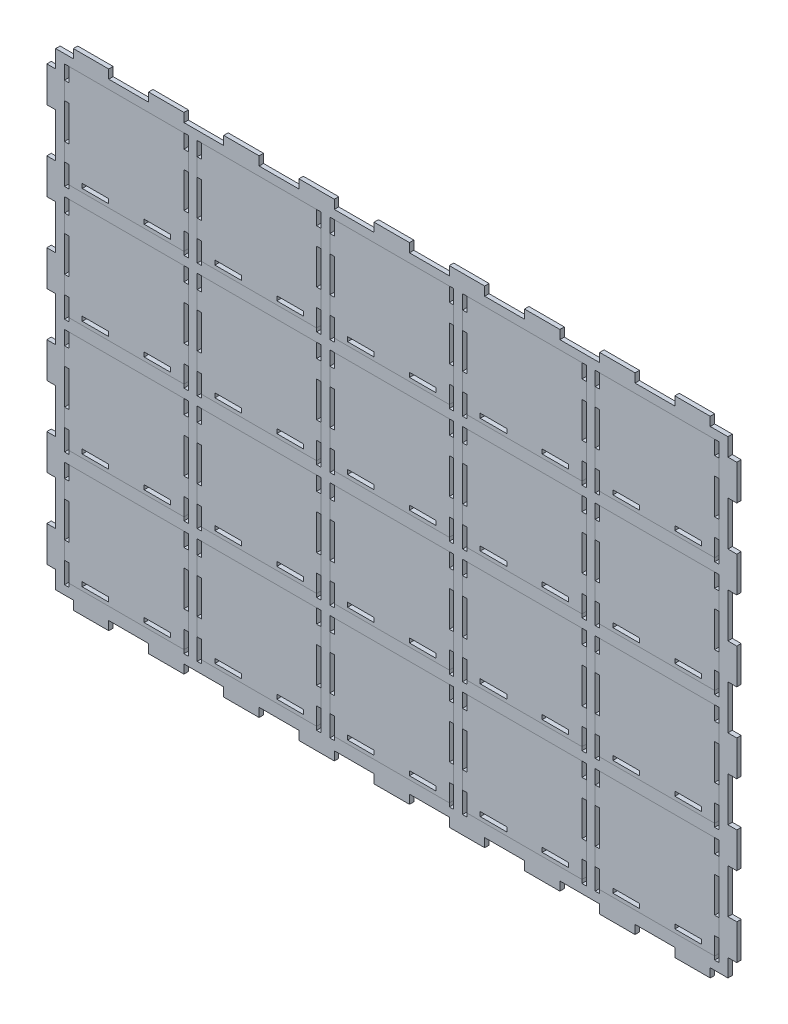
from build123d import *

# Parameters (mm, degrees)
BOSS_EXTRUDE1_DEPTH    = 2.5
SKETCH1_3_W            = 15
SKETCH1_3_H            = 2.5
BOSS_EXTRUDE2_DEPTH    = 2.5
BOSS_EXTRUDE2_2_DEPTH  = 2.5
BOSS_EXTRUDE2_3_DEPTH  = 2.5
BOSS_EXTRUDE2_4_DEPTH  = 2.5
BOSS_EXTRUDE2_5_DEPTH  = 2.5
BOSS_EXTRUDE2_6_DEPTH  = 2.5
BOSS_EXTRUDE2_7_DEPTH  = 2.5
BOSS_EXTRUDE2_8_DEPTH  = 2.5
BOSS_EXTRUDE2_9_DEPTH  = 2.5
BOSS_EXTRUDE2_10_DEPTH = 2.5
BOSS_EXTRUDE2_11_DEPTH = 2.5
BOSS_EXTRUDE2_12_DEPTH = 2.5
BOSS_EXTRUDE2_13_DEPTH = 2.5
BOSS_EXTRUDE2_14_DEPTH = 2.5
BOSS_EXTRUDE2_15_DEPTH = 2.5
BOSS_EXTRUDE2_16_DEPTH = 2.5
BOSS_EXTRUDE2_17_DEPTH = 2.5
BOSS_EXTRUDE2_18_DEPTH = 2.5
BOSS_EXTRUDE2_19_DEPTH = 2.5
BOSS_EXTRUDE2_20_DEPTH = 2.5


with BuildPart() as part:
    # Sketch1 → Boss-Extrude1 (new body)
    with BuildSketch(Plane.XY):
        Polygon((-160, 137.5), (-180, 137.5), (-180, 132.5), (-190, 132.5), (-190, 122.5), (-195, 122.5), (-195, 102.5), (-190, 102.5), (-190, 77.5), (-195, 77.5), (-195, 57.5), (-190, 57.5), (-190, 32.5), (-195, 32.5), (-195, 12.5), (-190, 12.5), (-190, -12.5), (-195, -12.5), (-195, -32.5), (-190, -32.5), (-190, -57.5), (-195, -57.5), (-195, -77.5), (-190, -77.5), (-190, -102.5), (-195, -102.5), (-195, -122.5), (-190, -122.5), (-190, -132.5), (-180, -132.5), (-180, -137.5), (-160, -137.5), (-160, -132.5), (-137.5, -132.5), (-137.5, -137.5), (-117.5, -137.5), (-117.5, -132.5), (-95, -132.5), (-95, -137.5), (-75, -137.5), (-75, -132.5), (-52.5, -132.5), (-52.5, -137.5), (-32.5, -137.5), (-32.5, -132.5), (-10, -132.5), (-10, -137.5), (10, -137.5), (10, -132.5), (32.5, -132.5), (32.5, -137.5), (52.5, -137.5), (52.5, -132.5), (75, -132.5), (75, -137.5), (95, -137.5), (95, -132.5), (117.5, -132.5), (117.5, -137.5), (137.5, -137.5), (137.5, -132.5), (160, -132.5), (160, -137.5), (180, -137.5), (180, -132.5), (190, -132.5), (190, -122.5), (195, -122.5), (195, -102.5), (190, -102.5), (190, -77.5), (195, -77.5), (195, -57.5), (190, -57.5), (190, -32.5), (195, -32.5), (195, -12.5), (190, -12.5), (190, 12.5), (195, 12.5), (195, 32.5), (190, 32.5), (190, 57.5), (195, 57.5), (195, 77.5), (190, 77.5), (190, 102.5), (195, 102.5), (195, 122.5), (190, 122.5), (190, 132.5), (180, 132.5), (180, 137.5), (160, 137.5), (160, 132.5), (137.5, 132.5), (137.5, 137.5), (117.5, 137.5), (117.5, 132.5), (95, 132.5), (95, 137.5), (75, 137.5), (75, 132.5), (52.5, 132.5), (52.5, 137.5), (32.5, 137.5), (32.5, 132.5), (10, 132.5), (10, 137.5), (-10, 137.5), (-10, 132.5), (-32.5, 132.5), (-32.5, 137.5), (-52.5, 137.5), (-52.5, 132.5), (-75, 132.5), (-75, 137.5), (-95, 137.5), (-95, 132.5), (-117.5, 132.5), (-117.5, 137.5), (-137.5, 137.5), (-137.5, 132.5), (-160, 132.5), align=None)
        Polygon((-182.5, -127.5), (-185, -127.5), (-185, -115.5), (-185, -105.5), (-185, -85.5), (-185, -75.5), (-185, -67.5), (-182.5, -67.5), (-117.5, -67.5), (-115, -67.5), (-115, -75.5), (-115, -85.5), (-115, -105.5), (-115, -115.5), (-115, -127.5), (-117.5, -127.5), (-117.5, -125.5), (-182.5, -125.5), align=None, mode=Mode.SUBTRACT)
        Polygon((-107.5, -127.5), (-110, -127.5), (-110, -115.5), (-110, -105.5), (-110, -85.5), (-110, -75.5), (-110, -67.5), (-107.5, -67.5), (-42.5, -67.5), (-40, -67.5), (-40, -75.5), (-40, -85.5), (-40, -105.5), (-40, -115.5), (-40, -127.5), (-42.5, -127.5), (-42.5, -125.5), (-107.5, -125.5), align=None, mode=Mode.SUBTRACT)
        Polygon((-182.5, -62.5), (-185, -62.5), (-185, -50.5), (-185, -40.5), (-185, -20.5), (-185, -10.5), (-185, -2.5), (-182.5, -2.5), (-117.5, -2.5), (-115, -2.5), (-115, -10.5), (-115, -20.5), (-115, -40.5), (-115, -50.5), (-115, -62.5), (-117.5, -62.5), (-117.5, -60.5), (-182.5, -60.5), align=None, mode=Mode.SUBTRACT)
        Polygon((-107.5, -62.5), (-110, -62.5), (-110, -50.5), (-110, -40.5), (-110, -20.5), (-110, -10.5), (-110, -2.5), (-107.5, -2.5), (-42.5, -2.5), (-40, -2.5), (-40, -10.5), (-40, -20.5), (-40, -40.5), (-40, -50.5), (-40, -62.5), (-42.5, -62.5), (-42.5, -60.5), (-107.5, -60.5), align=None, mode=Mode.SUBTRACT)
        Polygon((-32.5, -127.5), (-35, -127.5), (-35, -115.5), (-35, -105.5), (-35, -85.5), (-35, -75.5), (-35, -67.5), (-32.5, -67.5), (32.5, -67.5), (35, -67.5), (35, -75.5), (35, -85.5), (35, -105.5), (35, -115.5), (35, -127.5), (32.5, -127.5), (32.5, -125.5), (-32.5, -125.5), align=None, mode=Mode.SUBTRACT)
        Polygon((42.5, -127.5), (40, -127.5), (40, -115.5), (40, -105.5), (40, -85.5), (40, -75.5), (40, -67.5), (42.5, -67.5), (107.5, -67.5), (110, -67.5), (110, -75.5), (110, -85.5), (110, -105.5), (110, -115.5), (110, -127.5), (107.5, -127.5), (107.5, -125.5), (42.5, -125.5), align=None, mode=Mode.SUBTRACT)
        Polygon((117.5, -127.5), (115, -127.5), (115, -115.5), (115, -105.5), (115, -85.5), (115, -75.5), (115, -67.5), (117.5, -67.5), (182.5, -67.5), (185, -67.5), (185, -75.5), (185, -85.5), (185, -105.5), (185, -115.5), (185, -127.5), (182.5, -127.5), (182.5, -125.5), (117.5, -125.5), align=None, mode=Mode.SUBTRACT)
        Polygon((-32.5, -62.5), (-35, -62.5), (-35, -50.5), (-35, -40.5), (-35, -20.5), (-35, -10.5), (-35, -2.5), (-32.5, -2.5), (32.5, -2.5), (35, -2.5), (35, -10.5), (35, -20.5), (35, -40.5), (35, -50.5), (35, -62.5), (32.5, -62.5), (32.5, -60.5), (-32.5, -60.5), align=None, mode=Mode.SUBTRACT)
        Polygon((42.5, -62.5), (40, -62.5), (40, -50.5), (40, -40.5), (40, -20.5), (40, -10.5), (40, -2.5), (42.5, -2.5), (107.5, -2.5), (110, -2.5), (110, -10.5), (110, -20.5), (110, -40.5), (110, -50.5), (110, -62.5), (107.5, -62.5), (107.5, -60.5), (42.5, -60.5), align=None, mode=Mode.SUBTRACT)
        Polygon((117.5, -62.5), (115, -62.5), (115, -50.5), (115, -40.5), (115, -20.5), (115, -10.5), (115, -2.5), (117.5, -2.5), (182.5, -2.5), (185, -2.5), (185, -10.5), (185, -20.5), (185, -40.5), (185, -50.5), (185, -62.5), (182.5, -62.5), (182.5, -60.5), (117.5, -60.5), align=None, mode=Mode.SUBTRACT)
        Polygon((-182.5, 2.5), (-185, 2.5), (-185, 14.5), (-185, 24.5), (-185, 44.5), (-185, 54.5), (-185, 62.5), (-182.5, 62.5), (-117.5, 62.5), (-115, 62.5), (-115, 54.5), (-115, 44.5), (-115, 24.5), (-115, 14.5), (-115, 2.5), (-117.5, 2.5), (-117.5, 4.5), (-182.5, 4.5), align=None, mode=Mode.SUBTRACT)
        Polygon((-107.5, 2.5), (-110, 2.5), (-110, 14.5), (-110, 24.5), (-110, 44.5), (-110, 54.5), (-110, 62.5), (-107.5, 62.5), (-42.5, 62.5), (-40, 62.5), (-40, 54.5), (-40, 44.5), (-40, 24.5), (-40, 14.5), (-40, 2.5), (-42.5, 2.5), (-42.5, 4.5), (-107.5, 4.5), align=None, mode=Mode.SUBTRACT)
        Polygon((-182.5, 67.5), (-185, 67.5), (-185, 79.5), (-185, 89.5), (-185, 109.5), (-185, 119.5), (-185, 127.5), (-182.5, 127.5), (-117.5, 127.5), (-115, 127.5), (-115, 119.5), (-115, 109.5), (-115, 89.5), (-115, 79.5), (-115, 67.5), (-117.5, 67.5), (-117.5, 69.5), (-182.5, 69.5), align=None, mode=Mode.SUBTRACT)
        Polygon((-107.5, 67.5), (-110, 67.5), (-110, 79.5), (-110, 89.5), (-110, 109.5), (-110, 119.5), (-110, 127.5), (-107.5, 127.5), (-42.5, 127.5), (-40, 127.5), (-40, 119.5), (-40, 109.5), (-40, 89.5), (-40, 79.5), (-40, 67.5), (-42.5, 67.5), (-42.5, 69.5), (-107.5, 69.5), align=None, mode=Mode.SUBTRACT)
        Polygon((-32.5, 2.5), (-35, 2.5), (-35, 14.5), (-35, 24.5), (-35, 44.5), (-35, 54.5), (-35, 62.5), (-32.5, 62.5), (32.5, 62.5), (35, 62.5), (35, 54.5), (35, 44.5), (35, 24.5), (35, 14.5), (35, 2.5), (32.5, 2.5), (32.5, 4.5), (-32.5, 4.5), align=None, mode=Mode.SUBTRACT)
        Polygon((42.5, 2.5), (40, 2.5), (40, 14.5), (40, 24.5), (40, 44.5), (40, 54.5), (40, 62.5), (42.5, 62.5), (107.5, 62.5), (110, 62.5), (110, 54.5), (110, 44.5), (110, 24.5), (110, 14.5), (110, 2.5), (107.5, 2.5), (107.5, 4.5), (42.5, 4.5), align=None, mode=Mode.SUBTRACT)
        Polygon((117.5, 2.5), (115, 2.5), (115, 14.5), (115, 24.5), (115, 44.5), (115, 54.5), (115, 62.5), (117.5, 62.5), (182.5, 62.5), (185, 62.5), (185, 54.5), (185, 44.5), (185, 24.5), (185, 14.5), (185, 2.5), (182.5, 2.5), (182.5, 4.5), (117.5, 4.5), align=None, mode=Mode.SUBTRACT)
        Polygon((-32.5, 67.5), (-35, 67.5), (-35, 79.5), (-35, 89.5), (-35, 109.5), (-35, 119.5), (-35, 127.5), (-32.5, 127.5), (32.5, 127.5), (35, 127.5), (35, 119.5), (35, 109.5), (35, 89.5), (35, 79.5), (35, 67.5), (32.5, 67.5), (32.5, 69.5), (-32.5, 69.5), align=None, mode=Mode.SUBTRACT)
        Polygon((42.5, 67.5), (40, 67.5), (40, 79.5), (40, 89.5), (40, 109.5), (40, 119.5), (40, 127.5), (42.5, 127.5), (107.5, 127.5), (110, 127.5), (110, 119.5), (110, 109.5), (110, 89.5), (110, 79.5), (110, 67.5), (107.5, 67.5), (107.5, 69.5), (42.5, 69.5), align=None, mode=Mode.SUBTRACT)
        Polygon((117.5, 67.5), (115, 67.5), (115, 79.5), (115, 89.5), (115, 109.5), (115, 119.5), (115, 127.5), (117.5, 127.5), (182.5, 127.5), (185, 127.5), (185, 119.5), (185, 109.5), (185, 89.5), (185, 79.5), (185, 67.5), (182.5, 67.5), (182.5, 69.5), (117.5, 69.5), align=None, mode=Mode.SUBTRACT)
    extrude(amount=BOSS_EXTRUDE1_DEPTH)


with BuildPart() as body_2:
    # Sketch1<3> → Boss-Extrude2 (new body)
    with BuildSketch(Plane.XY):
        Polygon((115, 89.5), (115, 79.5), (117.5, 79.5), (117.5, 69.5), (182.5, 69.5), (182.5, 79.5), (185, 79.5), (185, 89.5), (182.5, 89.5), (182.5, 109.5), (185, 109.5), (185, 119.5), (182.5, 119.5), (182.5, 127.5), (117.5, 127.5), (117.5, 119.5), (115, 119.5), (115, 109.5), (117.5, 109.5), (117.5, 89.5), align=None)
        with Locations((132.5, 72.75)):
            Rectangle(SKETCH1_3_W, SKETCH1_3_H, mode=Mode.SUBTRACT)
        with Locations((167.5, 72.75)):
            Rectangle(SKETCH1_3_W, SKETCH1_3_H, mode=Mode.SUBTRACT)
    extrude(amount=BOSS_EXTRUDE2_DEPTH)


with BuildPart() as body_3:
    # Sketch1<3> → Boss-Extrude2 2 (new body)
    with BuildSketch(Plane.XY):
        Polygon((115, 24.5), (115, 14.5), (117.5, 14.5), (117.5, 4.5), (182.5, 4.5), (182.5, 14.5), (185, 14.5), (185, 24.5), (182.5, 24.5), (182.5, 44.5), (185, 44.5), (185, 54.5), (182.5, 54.5), (182.5, 62.5), (117.5, 62.5), (117.5, 54.5), (115, 54.5), (115, 44.5), (117.5, 44.5), (117.5, 24.5), align=None)
        with Locations((132.5, 7.75)):
            Rectangle(SKETCH1_3_W, SKETCH1_3_H, mode=Mode.SUBTRACT)
        with Locations((167.5, 7.75)):
            Rectangle(SKETCH1_3_W, SKETCH1_3_H, mode=Mode.SUBTRACT)
    extrude(amount=BOSS_EXTRUDE2_2_DEPTH)


with BuildPart() as body_4:
    # Sketch1<3> → Boss-Extrude2 3 (new body)
    with BuildSketch(Plane.XY):
        Polygon((115, -40.5), (115, -50.5), (117.5, -50.5), (117.5, -60.5), (182.5, -60.5), (182.5, -50.5), (185, -50.5), (185, -40.5), (182.5, -40.5), (182.5, -20.5), (185, -20.5), (185, -10.5), (182.5, -10.5), (182.5, -2.5), (117.5, -2.5), (117.5, -5.5), (117.5, -10.5), (115, -10.5), (115, -20.5), (117.5, -20.5), (117.5, -40.5), align=None)
        with Locations((132.5, -57.25)):
            Rectangle(SKETCH1_3_W, SKETCH1_3_H, mode=Mode.SUBTRACT)
        with Locations((167.5, -57.25)):
            Rectangle(SKETCH1_3_W, SKETCH1_3_H, mode=Mode.SUBTRACT)
    extrude(amount=BOSS_EXTRUDE2_3_DEPTH)


with BuildPart() as body_5:
    # Sketch1<3> → Boss-Extrude2 4 (new body)
    with BuildSketch(Plane.XY):
        Polygon((115, -105.5), (115, -115.5), (117.5, -115.5), (117.5, -125.5), (182.5, -125.5), (182.5, -115.5), (185, -115.5), (185, -105.5), (182.5, -105.5), (182.5, -85.5), (185, -85.5), (185, -75.5), (182.5, -75.5), (182.5, -67.5), (117.5, -67.5), (117.5, -70.5), (117.5, -75.5), (115, -75.5), (115, -85.5), (117.5, -85.5), (117.5, -105.5), align=None)
        with Locations((132.5, -122.25)):
            Rectangle(SKETCH1_3_W, SKETCH1_3_H, mode=Mode.SUBTRACT)
        with Locations((167.5, -122.25)):
            Rectangle(SKETCH1_3_W, SKETCH1_3_H, mode=Mode.SUBTRACT)
    extrude(amount=BOSS_EXTRUDE2_4_DEPTH)


with BuildPart() as body_6:
    # Sketch1<3> → Boss-Extrude2 5 (new body)
    with BuildSketch(Plane.XY):
        Polygon((40, 89.5), (40, 79.5), (42.5, 79.5), (42.5, 69.5), (107.5, 69.5), (107.5, 79.5), (110, 79.5), (110, 89.5), (107.5, 89.5), (107.5, 109.5), (110, 109.5), (110, 119.5), (107.5, 119.5), (107.5, 127.5), (42.5, 127.5), (42.5, 119.5), (40, 119.5), (40, 109.5), (42.5, 109.5), (42.5, 89.5), align=None)
        with Locations((57.5, 72.75)):
            Rectangle(SKETCH1_3_W, SKETCH1_3_H, mode=Mode.SUBTRACT)
        with Locations((92.5, 72.75)):
            Rectangle(SKETCH1_3_W, SKETCH1_3_H, mode=Mode.SUBTRACT)
    extrude(amount=BOSS_EXTRUDE2_5_DEPTH)


with BuildPart() as body_7:
    # Sketch1<3> → Boss-Extrude2 6 (new body)
    with BuildSketch(Plane.XY):
        Polygon((40, 24.5), (40, 14.5), (42.5, 14.5), (42.5, 4.5), (107.5, 4.5), (107.5, 14.5), (110, 14.5), (110, 24.5), (107.5, 24.5), (107.5, 44.5), (110, 44.5), (110, 54.5), (107.5, 54.5), (107.5, 62.5), (42.5, 62.5), (42.5, 54.5), (40, 54.5), (40, 44.5), (42.5, 44.5), (42.5, 24.5), align=None)
        with Locations((57.5, 7.75)):
            Rectangle(SKETCH1_3_W, SKETCH1_3_H, mode=Mode.SUBTRACT)
        with Locations((92.5, 7.75)):
            Rectangle(SKETCH1_3_W, SKETCH1_3_H, mode=Mode.SUBTRACT)
    extrude(amount=BOSS_EXTRUDE2_6_DEPTH)


with BuildPart() as body_8:
    # Sketch1<3> → Boss-Extrude2 7 (new body)
    with BuildSketch(Plane.XY):
        Polygon((40, -40.5), (40, -50.5), (42.5, -50.5), (42.5, -60.5), (107.5, -60.5), (107.5, -50.5), (110, -50.5), (110, -40.5), (107.5, -40.5), (107.5, -20.5), (110, -20.5), (110, -10.5), (107.5, -10.5), (107.5, -2.5), (42.5, -2.5), (42.5, -5.5), (42.5, -10.5), (40, -10.5), (40, -20.5), (42.5, -20.5), (42.5, -40.5), align=None)
        with Locations((57.5, -57.25)):
            Rectangle(SKETCH1_3_W, SKETCH1_3_H, mode=Mode.SUBTRACT)
        with Locations((92.5, -57.25)):
            Rectangle(SKETCH1_3_W, SKETCH1_3_H, mode=Mode.SUBTRACT)
    extrude(amount=BOSS_EXTRUDE2_7_DEPTH)


with BuildPart() as body_9:
    # Sketch1<3> → Boss-Extrude2 8 (new body)
    with BuildSketch(Plane.XY):
        Polygon((40, -105.5), (40, -115.5), (42.5, -115.5), (42.5, -125.5), (107.5, -125.5), (107.5, -115.5), (110, -115.5), (110, -105.5), (107.5, -105.5), (107.5, -85.5), (110, -85.5), (110, -75.5), (107.5, -75.5), (107.5, -67.5), (42.5, -67.5), (42.5, -70.5), (42.5, -75.5), (40, -75.5), (40, -85.5), (42.5, -85.5), (42.5, -105.5), align=None)
        with Locations((57.5, -122.25)):
            Rectangle(SKETCH1_3_W, SKETCH1_3_H, mode=Mode.SUBTRACT)
        with Locations((92.5, -122.25)):
            Rectangle(SKETCH1_3_W, SKETCH1_3_H, mode=Mode.SUBTRACT)
    extrude(amount=BOSS_EXTRUDE2_8_DEPTH)


with BuildPart() as body_10:
    # Sketch1<3> → Boss-Extrude2 9 (new body)
    with BuildSketch(Plane.XY):
        Polygon((-35, 89.5), (-35, 79.5), (-32.5, 79.5), (-32.5, 69.5), (32.5, 69.5), (32.5, 79.5), (35, 79.5), (35, 89.5), (32.5, 89.5), (32.5, 109.5), (35, 109.5), (35, 119.5), (32.5, 119.5), (32.5, 127.5), (-32.5, 127.5), (-32.5, 119.5), (-35, 119.5), (-35, 109.5), (-32.5, 109.5), (-32.5, 89.5), align=None)
        with Locations((-17.5, 72.75)):
            Rectangle(SKETCH1_3_W, SKETCH1_3_H, mode=Mode.SUBTRACT)
        with Locations((17.5, 72.75)):
            Rectangle(SKETCH1_3_W, SKETCH1_3_H, mode=Mode.SUBTRACT)
    extrude(amount=BOSS_EXTRUDE2_9_DEPTH)


with BuildPart() as body_11:
    # Sketch1<3> → Boss-Extrude2 10 (new body)
    with BuildSketch(Plane.XY):
        Polygon((-35, 24.5), (-35, 14.5), (-32.5, 14.5), (-32.5, 4.5), (32.5, 4.5), (32.5, 14.5), (35, 14.5), (35, 24.5), (32.5, 24.5), (32.5, 44.5), (35, 44.5), (35, 54.5), (32.5, 54.5), (32.5, 62.5), (-32.5, 62.5), (-32.5, 54.5), (-35, 54.5), (-35, 44.5), (-32.5, 44.5), (-32.5, 24.5), align=None)
        with Locations((-17.5, 7.75)):
            Rectangle(SKETCH1_3_W, SKETCH1_3_H, mode=Mode.SUBTRACT)
        with Locations((17.5, 7.75)):
            Rectangle(SKETCH1_3_W, SKETCH1_3_H, mode=Mode.SUBTRACT)
    extrude(amount=BOSS_EXTRUDE2_10_DEPTH)


with BuildPart() as body_12:
    # Sketch1<3> → Boss-Extrude2 11 (new body)
    with BuildSketch(Plane.XY):
        Polygon((-35, -40.5), (-35, -50.5), (-32.5, -50.5), (-32.5, -60.5), (32.5, -60.5), (32.5, -50.5), (35, -50.5), (35, -40.5), (32.5, -40.5), (32.5, -20.5), (35, -20.5), (35, -10.5), (32.5, -10.5), (32.5, -2.5), (-32.5, -2.5), (-32.5, -5.5), (-32.5, -10.5), (-35, -10.5), (-35, -20.5), (-32.5, -20.5), (-32.5, -40.5), align=None)
        with Locations((-17.5, -57.25)):
            Rectangle(SKETCH1_3_W, SKETCH1_3_H, mode=Mode.SUBTRACT)
        with Locations((17.5, -57.25)):
            Rectangle(SKETCH1_3_W, SKETCH1_3_H, mode=Mode.SUBTRACT)
    extrude(amount=BOSS_EXTRUDE2_11_DEPTH)


with BuildPart() as body_13:
    # Sketch1<3> → Boss-Extrude2 12 (new body)
    with BuildSketch(Plane.XY):
        Polygon((-35, -105.5), (-35, -115.5), (-32.5, -115.5), (-32.5, -125.5), (32.5, -125.5), (32.5, -115.5), (35, -115.5), (35, -105.5), (32.5, -105.5), (32.5, -85.5), (35, -85.5), (35, -75.5), (32.5, -75.5), (32.5, -67.5), (-32.5, -67.5), (-32.5, -70.5), (-32.5, -75.5), (-35, -75.5), (-35, -85.5), (-32.5, -85.5), (-32.5, -105.5), align=None)
        with Locations((-17.5, -122.25)):
            Rectangle(SKETCH1_3_W, SKETCH1_3_H, mode=Mode.SUBTRACT)
        with Locations((17.5, -122.25)):
            Rectangle(SKETCH1_3_W, SKETCH1_3_H, mode=Mode.SUBTRACT)
    extrude(amount=BOSS_EXTRUDE2_12_DEPTH)


with BuildPart() as body_14:
    # Sketch1<3> → Boss-Extrude2 13 (new body)
    with BuildSketch(Plane.XY):
        Polygon((-110, 89.5), (-110, 79.5), (-107.5, 79.5), (-107.5, 69.5), (-42.5, 69.5), (-42.5, 79.5), (-40, 79.5), (-40, 89.5), (-42.5, 89.5), (-42.5, 109.5), (-40, 109.5), (-40, 119.5), (-42.5, 119.5), (-42.5, 127.5), (-107.5, 127.5), (-107.5, 119.5), (-110, 119.5), (-110, 109.5), (-107.5, 109.5), (-107.5, 89.5), align=None)
        with Locations((-92.5, 72.75)):
            Rectangle(SKETCH1_3_W, SKETCH1_3_H, mode=Mode.SUBTRACT)
        with Locations((-57.5, 72.75)):
            Rectangle(SKETCH1_3_W, SKETCH1_3_H, mode=Mode.SUBTRACT)
    extrude(amount=BOSS_EXTRUDE2_13_DEPTH)


with BuildPart() as body_15:
    # Sketch1<3> → Boss-Extrude2 14 (new body)
    with BuildSketch(Plane.XY):
        Polygon((-110, 24.5), (-110, 14.5), (-107.5, 14.5), (-107.5, 4.5), (-42.5, 4.5), (-42.5, 14.5), (-40, 14.5), (-40, 24.5), (-42.5, 24.5), (-42.5, 44.5), (-40, 44.5), (-40, 54.5), (-42.5, 54.5), (-42.5, 62.5), (-107.5, 62.5), (-107.5, 54.5), (-110, 54.5), (-110, 44.5), (-107.5, 44.5), (-107.5, 24.5), align=None)
        with Locations((-92.5, 7.75)):
            Rectangle(SKETCH1_3_W, SKETCH1_3_H, mode=Mode.SUBTRACT)
        with Locations((-57.5, 7.75)):
            Rectangle(SKETCH1_3_W, SKETCH1_3_H, mode=Mode.SUBTRACT)
    extrude(amount=BOSS_EXTRUDE2_14_DEPTH)


with BuildPart() as body_16:
    # Sketch1<3> → Boss-Extrude2 15 (new body)
    with BuildSketch(Plane.XY):
        Polygon((-110, -40.5), (-110, -50.5), (-107.5, -50.5), (-107.5, -60.5), (-42.5, -60.5), (-42.5, -50.5), (-40, -50.5), (-40, -40.5), (-42.5, -40.5), (-42.5, -20.5), (-40, -20.5), (-40, -10.5), (-42.5, -10.5), (-42.5, -2.5), (-107.5, -2.5), (-107.5, -5.5), (-107.5, -10.5), (-110, -10.5), (-110, -20.5), (-107.5, -20.5), (-107.5, -40.5), align=None)
        with Locations((-92.5, -57.25)):
            Rectangle(SKETCH1_3_W, SKETCH1_3_H, mode=Mode.SUBTRACT)
        with Locations((-57.5, -57.25)):
            Rectangle(SKETCH1_3_W, SKETCH1_3_H, mode=Mode.SUBTRACT)
    extrude(amount=BOSS_EXTRUDE2_15_DEPTH)


with BuildPart() as body_17:
    # Sketch1<3> → Boss-Extrude2 16 (new body)
    with BuildSketch(Plane.XY):
        Polygon((-110, -105.5), (-110, -115.5), (-107.5, -115.5), (-107.5, -125.5), (-42.5, -125.5), (-42.5, -115.5), (-40, -115.5), (-40, -105.5), (-42.5, -105.5), (-42.5, -85.5), (-40, -85.5), (-40, -75.5), (-42.5, -75.5), (-42.5, -67.5), (-107.5, -67.5), (-107.5, -70.5), (-107.5, -75.5), (-110, -75.5), (-110, -85.5), (-107.5, -85.5), (-107.5, -105.5), align=None)
        with Locations((-92.5, -122.25)):
            Rectangle(SKETCH1_3_W, SKETCH1_3_H, mode=Mode.SUBTRACT)
        with Locations((-57.5, -122.25)):
            Rectangle(SKETCH1_3_W, SKETCH1_3_H, mode=Mode.SUBTRACT)
    extrude(amount=BOSS_EXTRUDE2_16_DEPTH)


with BuildPart() as body_18:
    # Sketch1<3> → Boss-Extrude2 17 (new body)
    with BuildSketch(Plane.XY):
        Polygon((-185, 89.5), (-185, 79.5), (-182.5, 79.5), (-182.5, 69.5), (-117.5, 69.5), (-117.5, 79.5), (-115, 79.5), (-115, 89.5), (-117.5, 89.5), (-117.5, 109.5), (-115, 109.5), (-115, 119.5), (-117.5, 119.5), (-117.5, 127.5), (-182.5, 127.5), (-182.5, 119.5), (-185, 119.5), (-185, 109.5), (-182.5, 109.5), (-182.5, 89.5), align=None)
        with Locations((-167.5, 72.75)):
            Rectangle(SKETCH1_3_W, SKETCH1_3_H, mode=Mode.SUBTRACT)
        with Locations((-132.5, 72.75)):
            Rectangle(SKETCH1_3_W, SKETCH1_3_H, mode=Mode.SUBTRACT)
    extrude(amount=BOSS_EXTRUDE2_17_DEPTH)


with BuildPart() as body_19:
    # Sketch1<3> → Boss-Extrude2 18 (new body)
    with BuildSketch(Plane.XY):
        Polygon((-185, 24.5), (-185, 14.5), (-182.5, 14.5), (-182.5, 4.5), (-117.5, 4.5), (-117.5, 14.5), (-115, 14.5), (-115, 24.5), (-117.5, 24.5), (-117.5, 44.5), (-115, 44.5), (-115, 54.5), (-117.5, 54.5), (-117.5, 62.5), (-182.5, 62.5), (-182.5, 54.5), (-185, 54.5), (-185, 44.5), (-182.5, 44.5), (-182.5, 24.5), align=None)
        with Locations((-167.5, 7.75)):
            Rectangle(SKETCH1_3_W, SKETCH1_3_H, mode=Mode.SUBTRACT)
        with Locations((-132.5, 7.75)):
            Rectangle(SKETCH1_3_W, SKETCH1_3_H, mode=Mode.SUBTRACT)
    extrude(amount=BOSS_EXTRUDE2_18_DEPTH)


with BuildPart() as body_20:
    # Sketch1<3> → Boss-Extrude2 19 (new body)
    with BuildSketch(Plane.XY):
        Polygon((-185, -40.5), (-185, -50.5), (-182.5, -50.5), (-182.5, -60.5), (-117.5, -60.5), (-117.5, -50.5), (-115, -50.5), (-115, -40.5), (-117.5, -40.5), (-117.5, -20.5), (-115, -20.5), (-115, -10.5), (-117.5, -10.5), (-117.5, -2.5), (-182.5, -2.5), (-182.5, -5.5), (-182.5, -10.5), (-185, -10.5), (-185, -20.5), (-182.5, -20.5), (-182.5, -40.5), align=None)
        with Locations((-167.5, -57.25)):
            Rectangle(SKETCH1_3_W, SKETCH1_3_H, mode=Mode.SUBTRACT)
        with Locations((-132.5, -57.25)):
            Rectangle(SKETCH1_3_W, SKETCH1_3_H, mode=Mode.SUBTRACT)
    extrude(amount=BOSS_EXTRUDE2_19_DEPTH)


with BuildPart() as body_21:
    # Sketch1<3> → Boss-Extrude2 20 (new body)
    with BuildSketch(Plane.XY):
        Polygon((-185, -105.5), (-185, -115.5), (-182.5, -115.5), (-182.5, -125.5), (-117.5, -125.5), (-117.5, -115.5), (-115, -115.5), (-115, -105.5), (-117.5, -105.5), (-117.5, -85.5), (-115, -85.5), (-115, -75.5), (-117.5, -75.5), (-117.5, -67.5), (-182.5, -67.5), (-182.5, -70.5), (-182.5, -75.5), (-185, -75.5), (-185, -85.5), (-182.5, -85.5), (-182.5, -105.5), align=None)
        with Locations((-167.5, -122.25)):
            Rectangle(SKETCH1_3_W, SKETCH1_3_H, mode=Mode.SUBTRACT)
        with Locations((-132.5, -122.25)):
            Rectangle(SKETCH1_3_W, SKETCH1_3_H, mode=Mode.SUBTRACT)
    extrude(amount=BOSS_EXTRUDE2_20_DEPTH)


solid = Compound([part.part, body_2.part, body_3.part, body_4.part, body_5.part, body_6.part, body_7.part, body_8.part, body_9.part, body_10.part, body_11.part, body_12.part, body_13.part, body_14.part, body_15.part, body_16.part, body_17.part, body_18.part, body_19.part, body_20.part, body_21.part])
